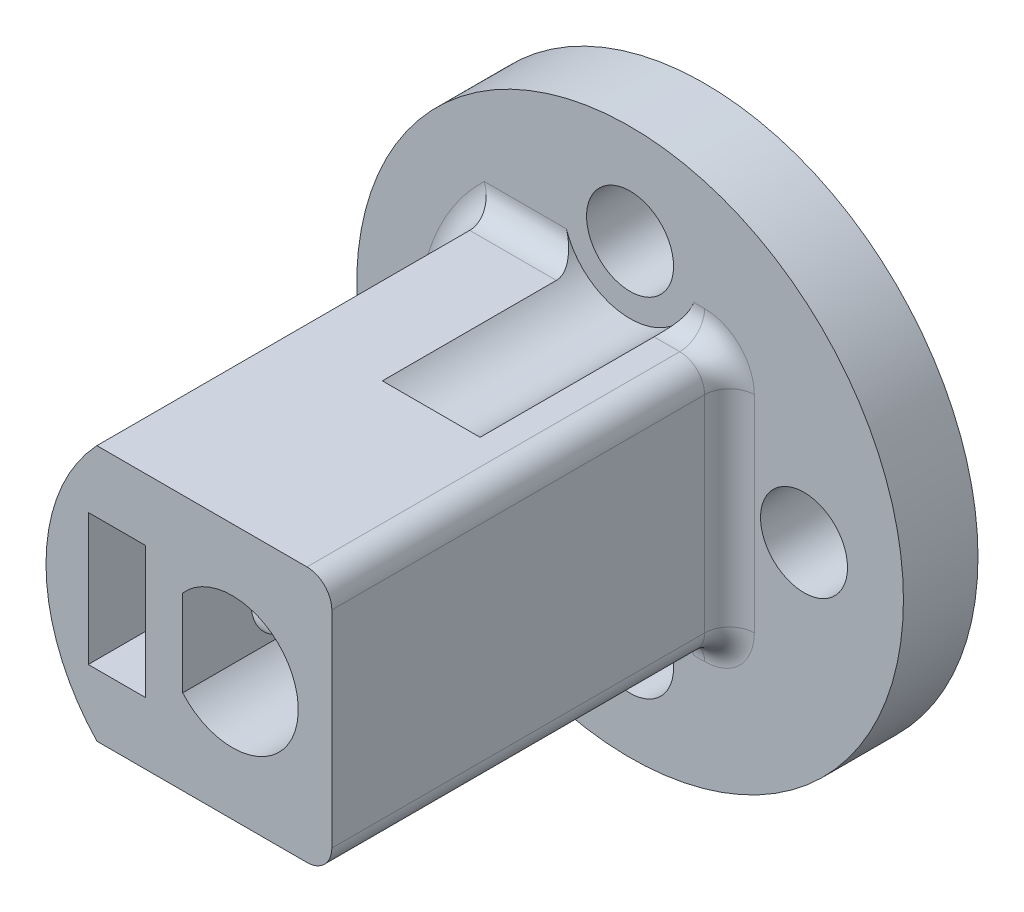
from build123d import *

# Parameters (mm, degrees)
SKETCH_1_R          = 11
SKETCH_1_R_2        = 1.75
EXTRUDE_1_DEPTH     = 3
SKETCH_2_R          = 7.5
EXTRUDE_2_DEPTH     = 16
SKETCH_10_W         = 2.3
SKETCH_10_H         = 5.3
CUT_EXTRUDE_4_DEPTH = 16
CUT_EXTRUDE_START   = -16
CUT_EXTRUDE_5_DEPTH = 16
SKETCH_13_R         = 2.7
CUT_EXTRUDE_6_DEPTH = 8
FILLET_1_R          = 1
SKETCH_15_R         = 1.75
CUT_EXTRUDE_7_DEPTH = 10


with BuildPart() as part:
    # 草图1 → 凸台-拉伸1 (new body)
    with BuildSketch(Plane.XY):
        Circle(SKETCH_1_R)
        with Locations((0, 7)):
            Circle(SKETCH_1_R_2, mode=Mode.SUBTRACT)
        with Locations((7, 0)):
            Circle(SKETCH_1_R_2, mode=Mode.SUBTRACT)
        with Locations((0, -7)):
            Circle(SKETCH_1_R_2, mode=Mode.SUBTRACT)
        with Locations((-7, 0)):
            Circle(SKETCH_1_R_2, mode=Mode.SUBTRACT)
    extrude(amount=EXTRUDE_1_DEPTH)

    # 草图2 → 凸台-拉伸2 (add)
    with BuildSketch(Plane.XY.offset(3)):
        with Locations(Location((0, 0, 0), (0, 0, 166.708822757))):
            Circle(SKETCH_2_R)
        with BuildLine():
            Line((-2, 1.738533865), (-2, -1.738533865))
            ThreePointArc((-2, -1.738533865), (-1.295035867, -2.31200824), (-0.437775279, -2.613590022))
            ThreePointArc((-0.437775279, -2.613590022), (2.018459157, -1.717068034), (2.50959842, 0.851126176))
            ThreePointArc((2.50959842, 0.851126176), (0.511659788, 2.600135431), (-2, 1.738533865))
        make_face(mode=Mode.SUBTRACT)
    extrude(amount=EXTRUDE_2_DEPTH)

    # 草图10 → 切除-拉伸4 (cut)
    with BuildSketch(Plane.XY.offset(19)):
        with Locations((-4.65, 0)):
            Rectangle(SKETCH_10_W, SKETCH_10_H)
    extrude(amount=-CUT_EXTRUDE_4_DEPTH, mode=Mode.SUBTRACT)

    # 草图12 → 切除-拉伸5 (cut)
    with BuildSketch(Plane.XY.offset(19).offset(CUT_EXTRUDE_START)):
        with BuildLine():
            Line((-5.452293096, 5.15), (4, 5.15))
            Line((4, 5.15), (4, -5.15))
            Line((4, -5.15), (-5.452293096, -5.15))
            ThreePointArc((-5.452293096, -5.15), (7.5, 0), (-5.452293096, 5.15))
        make_face()
    extrude(amount=CUT_EXTRUDE_5_DEPTH, mode=Mode.SUBTRACT)

    # 草图13 → 切除-拉伸6 (cut)
    with BuildSketch(Plane.XY.offset(3)):
        with Locations((0, 7)):
            Circle(SKETCH_13_R)
        with Locations((7, 0)):
            Circle(SKETCH_13_R)
        with Locations((0, -7)):
            Circle(SKETCH_13_R)
        with Locations((-7, 0)):
            Circle(SKETCH_13_R)
    extrude(amount=CUT_EXTRUDE_6_DEPTH, mode=Mode.SUBTRACT)

    # 圆角1
    # the kernel refuses this fillet: 1 mm, written as the material it adds along each edge
    with BuildSketch(Plane(origin=(0, 0, 3), x_dir=(-0.46227667345108353, 0.8867357425879484, 0), z_dir=(0.8867357425879484, 0.46227667345108353, 0))) as fillet_1_piece_1_section:
        with BuildLine():
            CenterArc((7.5 + FILLET_1_R, FILLET_1_R), FILLET_1_R, 180, 90)
            Line((7.5, FILLET_1_R), (7.5, 0))
            Line((7.5, 0), (7.5 + FILLET_1_R, 0))
        make_face()
    fillet_1_piece_1 = revolve(axis=Axis((0, 0, 3), (0, 0, 1)), revolution_arc=60.46476408, mode=Mode.PRIVATE)
    fillet_1_piece_1 = fillet_1_piece_1 - Plane(origin=(-7, 0, 3.226381538), x_dir=(1, 0, 0), z_dir=(0, 0, -1)) * Cylinder(2.7, 34, mode=Mode.PRIVATE)
    fillet_1_piece_1 = split(fillet_1_piece_1, bisect_by=Plane(origin=(-6.580020659, 5.15, 3.226381538), z_dir=(0, -1, 0)), keep=Keep.TOP, mode=Mode.PRIVATE)
    add(fillet_1_piece_1)
    with BuildSketch(Plane(origin=(0.533403956, -5.15, 3), x_dir=(0, -1, 0), z_dir=(-1, 0, 0))) as fillet_1_piece_2_section:
        with BuildLine():
            CenterArc((FILLET_1_R, FILLET_1_R), FILLET_1_R, 180, 90)
            Line((0, FILLET_1_R), (0, 0))
            Line((0, 0), (FILLET_1_R, 0))
        make_face()
    fillet_1_piece_2 = extrude(amount=8.485697052, mode=Mode.PRIVATE)
    fillet_1_piece_2 = fillet_1_piece_2 - Plane(origin=(0, -7, 3.242251881), x_dir=(1, 0, 0), z_dir=(0, 0, -1)) * Cylinder(2.7, 21, mode=Mode.PRIVATE)
    fillet_1_piece_2 = fillet_1_piece_2 & Plane(origin=(0, 0, 3.242251881), x_dir=(-0.9732142857144194, 0.2298998783848582, 0), z_dir=(0, 0, -1)) * Cylinder(7.5, 21, mode=Mode.PRIVATE)
    add(fillet_1_piece_2)
    with BuildSketch(Plane(origin=(-7.952293096, 5.15, 3), x_dir=(0, 1, 0), z_dir=(1, 0, 0))) as fillet_1_piece_3_section:
        with BuildLine():
            CenterArc((FILLET_1_R, FILLET_1_R), FILLET_1_R, 180, 90)
            Line((0, FILLET_1_R), (0, 0))
            Line((0, 0), (FILLET_1_R, 0))
        make_face()
    fillet_1_piece_3 = extrude(amount=8.485697052, mode=Mode.PRIVATE)
    fillet_1_piece_3 = fillet_1_piece_3 - Plane(origin=(0, 7, 3.242252003), x_dir=(1, 0, 0), z_dir=(0, 0, -1)) * Cylinder(2.7, 21, mode=Mode.PRIVATE)
    fillet_1_piece_3 = fillet_1_piece_3 & Plane(origin=(0, 0, 3.242252003), x_dir=(-0.9732142857144194, 0.2298998783848582, 0), z_dir=(0, 0, -1)) * Cylinder(7.5, 21, mode=Mode.PRIVATE)
    add(fillet_1_piece_3)
    with BuildSketch(Plane(origin=(0, 0, 3), x_dir=(-0.9993901440206632, -0.034919049734468105, 0), z_dir=(-0.034919049734468105, 0.9993901440206632, 0))) as fillet_1_piece_4_section:
        with BuildLine():
            CenterArc((7.5 + FILLET_1_R, FILLET_1_R), FILLET_1_R, 180, 90)
            Line((7.5, FILLET_1_R), (7.5, 0))
            Line((7.5, 0), (7.5 + FILLET_1_R, 0))
        make_face()
    fillet_1_piece_4 = revolve(axis=Axis((0, 0, 3), (0, 0, 1)), revolution_arc=60.46476408, mode=Mode.PRIVATE)
    fillet_1_piece_4 = fillet_1_piece_4 - Plane(origin=(-7, 0, 3.226381502), x_dir=(1, 0, 0), z_dir=(0, 0, -1)) * Cylinder(2.7, 35, mode=Mode.PRIVATE)
    fillet_1_piece_4 = split(fillet_1_piece_4, bisect_by=Plane(origin=(-6.580021181, -5.15, 3.226381502), z_dir=(0, 1, 0)), keep=Keep.TOP, mode=Mode.PRIVATE)
    add(fillet_1_piece_4)
    with BuildSketch(Plane(origin=(0, 0, 3), x_dir=(-0.46227667345108353, 0.8867357425879484, 0), z_dir=(0.8867357425879484, 0.46227667345108353, 0))) as fillet_1_piece_5a_section:
        with BuildLine():
            CenterArc((7.5 + FILLET_1_R, FILLET_1_R), FILLET_1_R, 180, 90)
            Line((7.5, FILLET_1_R), (7.5, 0))
            Line((7.5, 0), (7.5 + FILLET_1_R, 0))
        make_face()
    fillet_1_piece_5a = revolve(axis=Axis((0, 0, 3), (0, 0, 1)), revolution_arc=60.46476408, mode=Mode.PRIVATE)
    fillet_1_piece_5a = split(fillet_1_piece_5a, bisect_by=Plane(origin=(-4.735225186, 5.15, 3.214069689), z_dir=(0, 1, 0)), keep=Keep.TOP, mode=Mode.PRIVATE)
    with BuildSketch(Plane(origin=(-7.952293096, 5.15, 3), x_dir=(0, 1, 0), z_dir=(1, 0, 0))) as fillet_1_piece_5b_section:
        with BuildLine():
            CenterArc((FILLET_1_R, FILLET_1_R), FILLET_1_R, 180, 90)
            Line((0, FILLET_1_R), (0, 0))
            Line((0, 0), (FILLET_1_R, 0))
        make_face()
    fillet_1_piece_5b = extrude(amount=8.485697052, mode=Mode.PRIVATE)
    fillet_1_piece_5b = fillet_1_piece_5b - Plane(origin=(0, 0, 3.215737548), x_dir=(-0.9732142857144194, 0.2298998783848582, 0), z_dir=(0, 0, -1)) * Cylinder(7.5, 21, mode=Mode.PRIVATE)
    fillet_1_piece_5 = fillet_1_piece_5a & fillet_1_piece_5b
    add(fillet_1_piece_5)
    with BuildSketch(Plane(origin=(0.533403956, -5.15, 3), x_dir=(0, -1, 0), z_dir=(-1, 0, 0))) as fillet_1_piece_6a_section:
        with BuildLine():
            CenterArc((FILLET_1_R, FILLET_1_R), FILLET_1_R, 180, 90)
            Line((0, FILLET_1_R), (0, 0))
            Line((0, 0), (FILLET_1_R, 0))
        make_face()
    fillet_1_piece_6a = extrude(amount=8.485697052, mode=Mode.PRIVATE)
    fillet_1_piece_6a = fillet_1_piece_6a - Plane(origin=(0, 0, 3.215737542), x_dir=(-0.9732142857144194, 0.2298998783848582, 0), z_dir=(0, 0, -1)) * Cylinder(7.5, 21, mode=Mode.PRIVATE)
    with BuildSketch(Plane(origin=(0, 0, 3), x_dir=(-0.9993901440206632, -0.034919049734468105, 0), z_dir=(-0.034919049734468105, 0.9993901440206632, 0))) as fillet_1_piece_6b_section:
        with BuildLine():
            CenterArc((7.5 + FILLET_1_R, FILLET_1_R), FILLET_1_R, 180, 90)
            Line((7.5, FILLET_1_R), (7.5, 0))
            Line((7.5, 0), (7.5 + FILLET_1_R, 0))
        make_face()
    fillet_1_piece_6b = revolve(axis=Axis((0, 0, 3), (0, 0, 1)), revolution_arc=60.46476408, mode=Mode.PRIVATE)
    fillet_1_piece_6b = split(fillet_1_piece_6b, bisect_by=Plane(origin=(-4.735225263, -5.15, 3.214069799), z_dir=(0, -1, 0)), keep=Keep.TOP, mode=Mode.PRIVATE)
    fillet_1_piece_6 = fillet_1_piece_6a & fillet_1_piece_6b
    add(fillet_1_piece_6)
    # the kernel refuses this fillet: 1 mm, written as the material it takes off along each edge
    with BuildSketch(Plane(origin=(4, -5.15, 3), x_dir=(-1, 0, 0), z_dir=(0, 0, 1)), Plane(origin=(4, 5.15, 3), x_dir=(0, -1, 0), z_dir=(0, 0, 1))) as fillet_1_2_piece_1:
        with BuildLine():
            CenterArc((FILLET_1_R, -FILLET_1_R), FILLET_1_R, 90, 90)
            Line((0, -FILLET_1_R), (0, 0))
            Line((0, 0), (FILLET_1_R, 0))
        make_face()
    extrude(amount=18.5, mode=Mode.SUBTRACT)
    # the kernel refuses this fillet: 1 mm, written as the material it adds along each edge
    with BuildSketch(Plane(origin=(4, 4.15, 3), x_dir=(1, 0, 0), z_dir=(0, -1, 0))) as fillet_1_3_piece_1:
        with BuildLine():
            CenterArc((FILLET_1_R, FILLET_1_R), FILLET_1_R, 180, 90)
            Line((0, FILLET_1_R), (0, 0))
            Line((0, 0), (FILLET_1_R, 0))
        make_face()
    extrude(amount=8.3)
    with BuildSketch(Plane(origin=(-0.533403956, 5.15, 3), x_dir=(0, 1, 0), z_dir=(1, 0, 0))) as fillet_1_3_piece_2_section:
        with BuildLine():
            CenterArc((FILLET_1_R, FILLET_1_R), FILLET_1_R, 180, 90)
            Line((0, FILLET_1_R), (0, 0))
            Line((0, 0), (FILLET_1_R, 0))
        make_face()
    fillet_1_3_piece_2 = extrude(amount=3.533403956, mode=Mode.PRIVATE)
    fillet_1_3_piece_2 = fillet_1_3_piece_2 - Plane(origin=(0, 7, 3.249320301), x_dir=(1, 0, 0), z_dir=(0, 0, -1)) * Cylinder(2.7, 12, mode=Mode.PRIVATE)
    add(fillet_1_3_piece_2)
    with BuildSketch(Plane(origin=(3, -5.15, 3), x_dir=(0, -1, 0), z_dir=(-1, 0, 0))) as fillet_1_3_piece_3_section:
        with BuildLine():
            CenterArc((FILLET_1_R, FILLET_1_R), FILLET_1_R, 180, 90)
            Line((0, FILLET_1_R), (0, 0))
            Line((0, 0), (FILLET_1_R, 0))
        make_face()
    fillet_1_3_piece_3 = extrude(amount=3.533403956, mode=Mode.PRIVATE)
    fillet_1_3_piece_3 = fillet_1_3_piece_3 - Plane(origin=(0, -7, 3.249320301), x_dir=(1, 0, 0), z_dir=(0, 0, -1)) * Cylinder(2.7, 12, mode=Mode.PRIVATE)
    add(fillet_1_3_piece_3)
    with BuildSketch(Plane(origin=(3, -4.15, 3), x_dir=(0, -1, 0), z_dir=(-1, 0, 0))) as fillet_1_3_piece_4:
        with BuildLine():
            CenterArc((1 + FILLET_1_R, FILLET_1_R), FILLET_1_R, 180, 90)
            Line((1, FILLET_1_R), (1, 0))
            Line((1, 0), (1 + FILLET_1_R, 0))
        make_face()
    revolve(axis=Axis((3, -4.15, 3), (0, 0, 1)), revolution_arc=90)
    with BuildSketch(Plane(origin=(3, 4.15, 3), x_dir=(1, 0, 0), z_dir=(0, -1, 0))) as fillet_1_3_piece_5:
        with BuildLine():
            CenterArc((1 + FILLET_1_R, FILLET_1_R), FILLET_1_R, 180, 90)
            Line((1, FILLET_1_R), (1, 0))
            Line((1, 0), (1 + FILLET_1_R, 0))
        make_face()
    revolve(axis=Axis((3, 4.15, 3), (0, 0, 1)), revolution_arc=90)

    # 草图15 → 切除-拉伸7 (cut)
    with BuildSketch(Plane(origin=(-10.8, 0, 0), x_dir=(0, 0, -1), z_dir=(1, 0, 0))):
        with Locations(Location((-14.5, 0, 0), (0, 0, 263.437572131))):
            Circle(SKETCH_15_R)
    extrude(amount=CUT_EXTRUDE_7_DEPTH, mode=Mode.SUBTRACT)


solid = part.part
